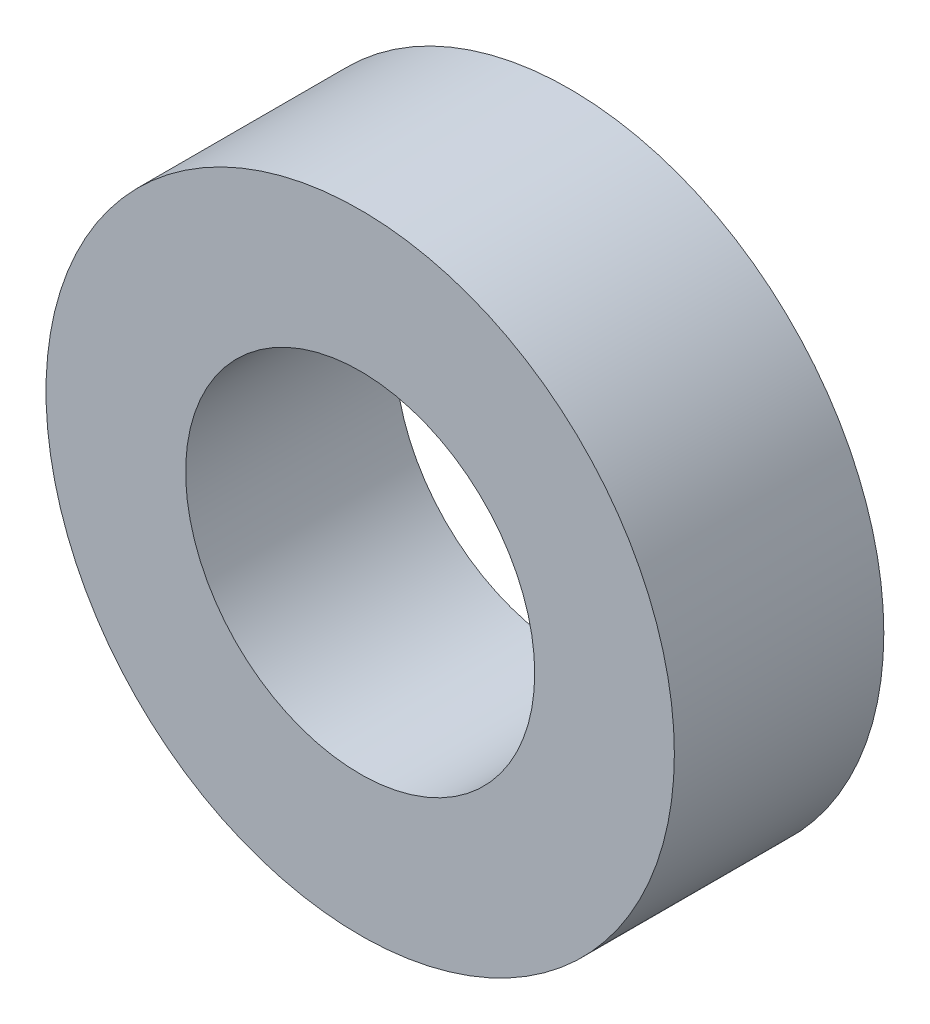
from build123d import *

# Parameters (mm, degrees)
SKETCH_1_R      = 4.5
SKETCH_1_R_2    = 2.5
EXTRUDE_1_DEPTH = 3


with BuildPart() as part:
    # 草图1 → 凸台-拉伸1 (new body)
    with BuildSketch(Plane.XY):
        Circle(SKETCH_1_R)
        Circle(SKETCH_1_R_2, mode=Mode.SUBTRACT)
    extrude(amount=EXTRUDE_1_DEPTH)


solid = part.part
